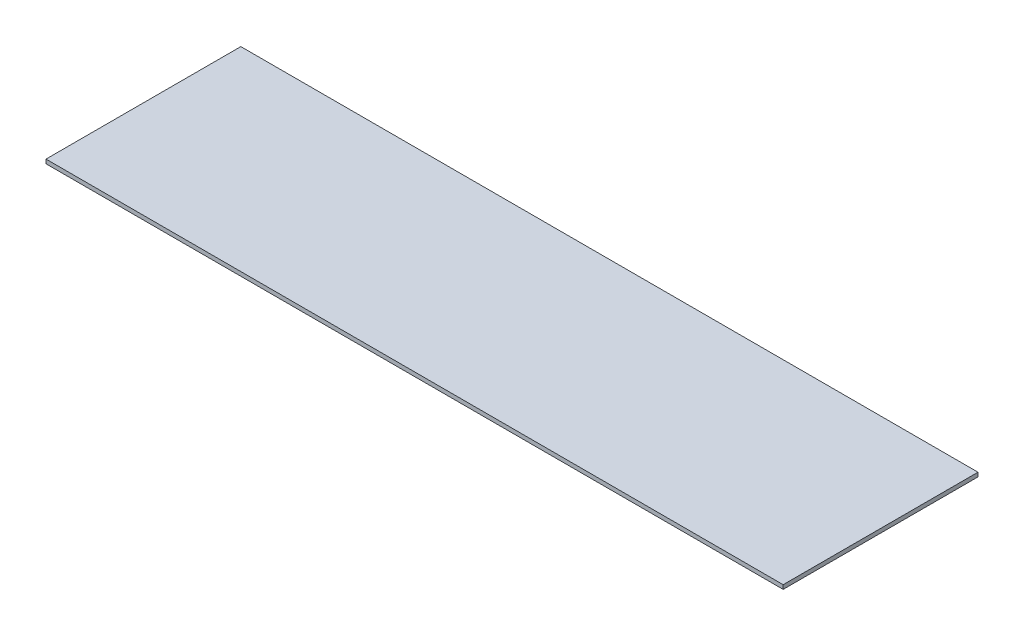
from build123d import *

# Parameters (mm, degrees)
SKETCH1_W           = 228.727
SKETCH1_H           = 60.452
BOSS_EXTRUDE1_DEPTH = 1.27


with BuildPart() as part:
    # Sketch1 → Boss-Extrude1 (new body)
    with BuildSketch(Plane(origin=(0, 0, 0), x_dir=(1, 0, 0), z_dir=(0, 1, 0))):
        with Locations((114.3635, 30.226)):
            Rectangle(SKETCH1_W, SKETCH1_H)
    extrude(amount=BOSS_EXTRUDE1_DEPTH)


solid = part.part
